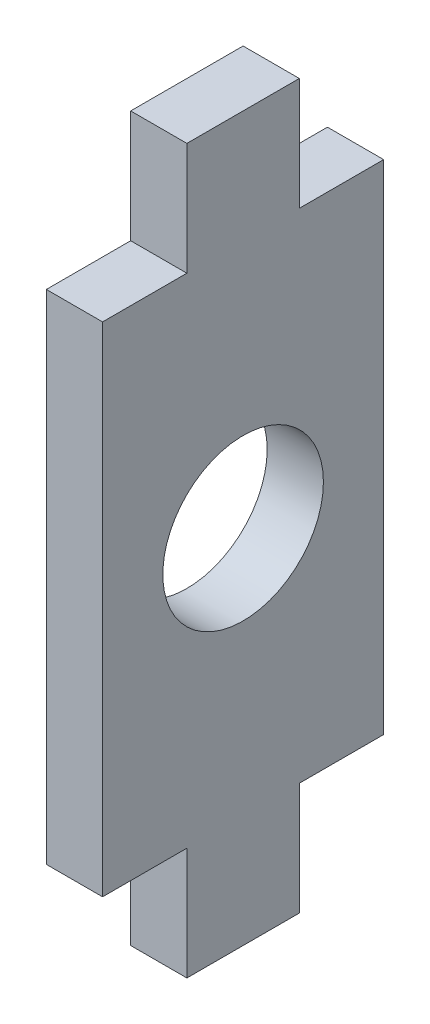
from build123d import *

# Parameters (mm, degrees)
BOSS_EXTRUDE1_DEPTH = 7
SKETCH2_R           = 10
CUT_EXTRUDE1_DEPTH  = 49.787805854


with BuildPart() as part:
    # Sketch1 → Boss-Extrude1 (new body)
    with BuildSketch(Plane(origin=(0, 0, 0), x_dir=(0, 0, -1), z_dir=(1, 0, 0))):
        Polygon((-7, -31), (-7, -45), (7, -45), (7, -31), (17.5, -31), (17.5, 31), (7, 31), (7, 45), (-7, 45), (-7, 31), (-17.5, 31), (-17.5, -31), align=None)
    extrude(amount=BOSS_EXTRUDE1_DEPTH)

    # Sketch2 → Cut-Extrude1 (cut, through all)
    with BuildSketch(Plane(origin=(7, 0, 0), x_dir=(0, 0, -1), z_dir=(1, 0, 0))):
        Circle(SKETCH2_R)
    extrude(amount=-CUT_EXTRUDE1_DEPTH, mode=Mode.SUBTRACT)


solid = part.part
